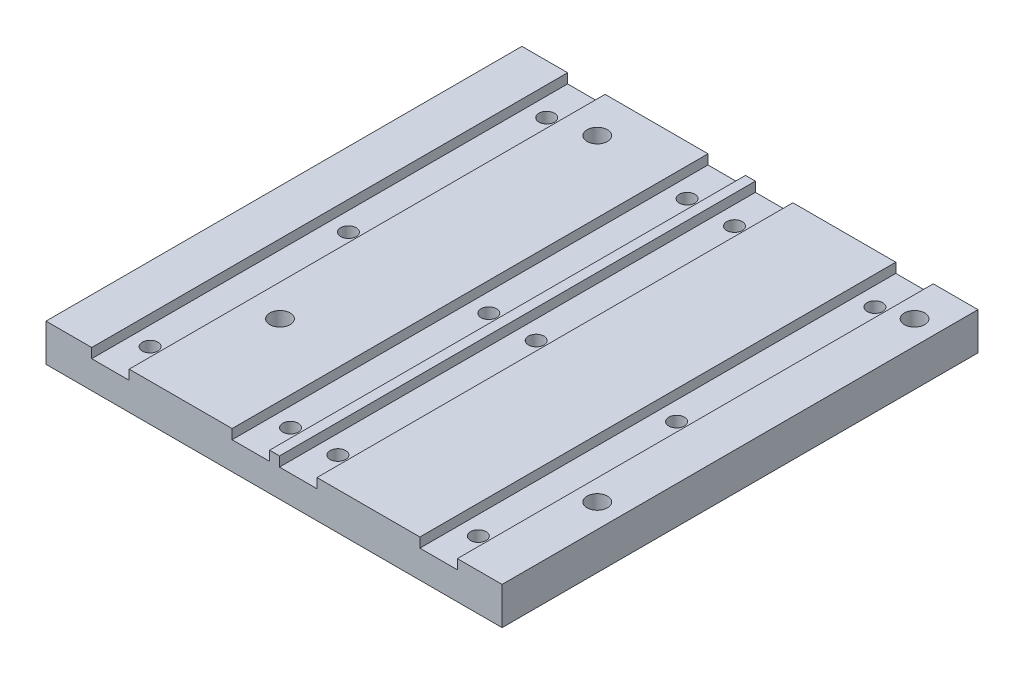
from build123d import *

# Parameters (mm, degrees)
SKETCH1_W                                       = 146.05
SKETCH1_H                                       = 152.4
BOSS_EXTRUDE1_DEPTH                             = 12
F_1_4_CLEARANCE_HOLE1_D                         = 6.5278
SKETCH4_W                                       = 12
SKETCH4_H                                       = 3.11
CUT_EXTRUDE1_DEPTH                              = 170.417858046
CBORE_FOR_10_SOCKET_HEAD_CAP_SCREW1_D           = 4.9784
CBORE_FOR_10_SOCKET_HEAD_CAP_SCREW1_CBORE_D     = 9.525
CBORE_FOR_10_SOCKET_HEAD_CAP_SCREW1_CBORE_DEPTH = 5.08
LPATTERN1_COUNT                                 = 2
LPATTERN1_PITCH                                 = 44.958
LPATTERN1_COUNT_DIR2                            = 2
LPATTERN1_PITCH_DIR2                            = 60.132999876


with BuildPart() as part:
    # Sketch1 → Boss-Extrude1 (new body)
    with BuildSketch(Plane(origin=(0, 0, 0), x_dir=(1, 0, 0), z_dir=(0, 1, 0))):
        Rectangle(SKETCH1_W, SKETCH1_H)
    extrude(amount=-BOSS_EXTRUDE1_DEPTH)

    # 1/4 Clearance Hole1 (through all)
    with Locations(Plane(origin=(0, 0, 0), x_dir=(1, 0, 0), z_dir=(0, 1, 0))):
        with Locations((-36.195, 63.5), (-36.195, -38.1), (65.405, -38.1), (65.405, 63.5)):
            Hole(F_1_4_CLEARANCE_HOLE1_D / 2)

    # Sketch4 → Cut-Extrude1 (cut, through all)
    with BuildSketch(Plane.XY.offset(76.2)):
        with Locations((52.705, -1.555)):
            Rectangle(SKETCH4_W, SKETCH4_H)
    cut_extrude1 = extrude(amount=-CUT_EXTRUDE1_DEPTH, mode=Mode.SUBTRACT)

    # CBORE for #10 Socket Head Cap Screw1 (through all)
    with Locations(Plane(origin=(0, -12, 0), x_dir=(-1, 0, 0), z_dir=(0, -1, 0))):
        with Locations((-52.705, -63.5), (-52.705, 63.5), (-52.705, 0)):
            cbore_for_10_socket_head_cap_screw1 = CounterBoreHole(CBORE_FOR_10_SOCKET_HEAD_CAP_SCREW1_D / 2, CBORE_FOR_10_SOCKET_HEAD_CAP_SCREW1_CBORE_D / 2, CBORE_FOR_10_SOCKET_HEAD_CAP_SCREW1_CBORE_DEPTH)

    # LPattern1: Cut-Extrude1, CBORE for _10 Socket Head Cap Screw1 2 × 2
    with Locations(*[Vector(-1, 0, 0) * (i * LPATTERN1_PITCH) + Vector(-1, 0, 0) * (j * LPATTERN1_PITCH_DIR2) for i in range(LPATTERN1_COUNT) for j in range(LPATTERN1_COUNT_DIR2) if (i, j) != (0, 0)]):
        add(cut_extrude1, mode=Mode.SUBTRACT)
        add(cbore_for_10_socket_head_cap_screw1, mode=Mode.SUBTRACT)


solid = part.part
